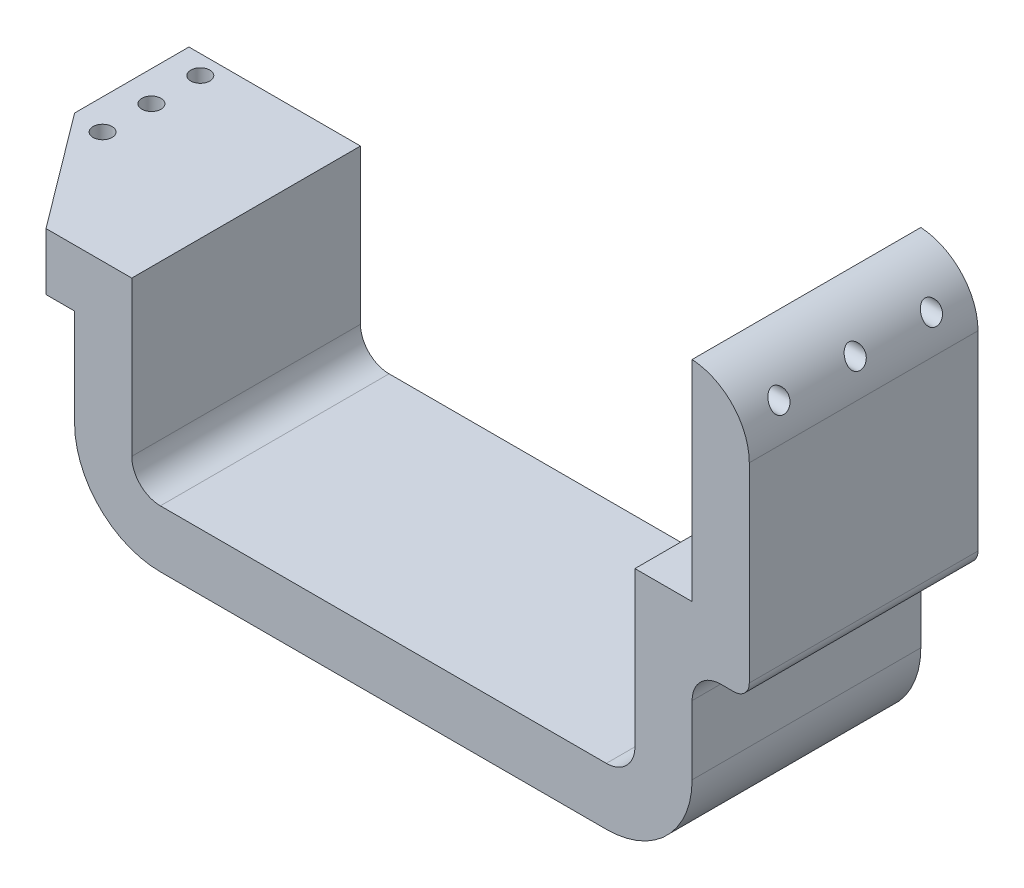
from build123d import *

# Parameters (mm, degrees)
BOSS_EXTRUDE1_DEPTH = 38.1
FILLET1_R           = 2.54
FILLET2_R           = 10.16
CUT_EXTRUDE2_DEPTH  = 91.653895256
SKETCH3_R           = 1.5875
CUT_EXTRUDE3_DEPTH  = 91.653895256
SKETCH4_R           = 1.5875
CUT_EXTRUDE4_DEPTH  = 145.905274839


with BuildPart() as part:
    # Sketch1 → Boss-Extrude1 (new body)
    with BuildSketch(Plane.XY):
        with BuildLine():
            Line((-35.8775, -27.305), (38.4175, -27.305))
            ThreePointArc((38.4175, -27.305), (48.520288136, -23.120288136), (52.705, -13.0175))
            Line((52.705, -13.0175), (52.705, -1.5875))
            ThreePointArc((52.705, -1.5875), (54.099903955, 1.780096045), (57.4675, 3.175))
            Line((57.4675, 3.175), (62.23, 3.175))
            Line((62.23, 3.175), (62.23, 47.625))
            Line((62.23, 47.625), (52.705, 47.625))
            Line((52.705, 47.625), (52.705, 12.7))
            Line((52.705, 12.7), (43.18, 12.7))
            Line((43.18, 12.7), (43.18, -13.0175))
            ThreePointArc((43.18, -13.0175), (41.785096045, -16.385096045), (38.4175, -17.78))
            Line((38.4175, -17.78), (-35.8775, -17.78))
            ThreePointArc((-35.8775, -17.78), (-39.245096045, -16.385096045), (-40.64, -13.0175))
            Line((-40.64, -13.0175), (-40.64, 12.7))
            Line((-40.64, 12.7), (-50.165, 12.7))
            Line((-50.165, 12.7), (-59.69, 12.7))
            Line((-59.69, 12.7), (-69.215, 12.7))
            Line((-69.215, 12.7), (-69.215, 3.175))
            Line((-69.215, 3.175), (-50.165, 3.175))
            Line((-50.165, 3.175), (-50.165, -13.0175))
            ThreePointArc((-50.165, -13.0175), (-45.980288136, -23.120288136), (-35.8775, -27.305))
        make_face()
    extrude(amount=BOSS_EXTRUDE1_DEPTH)

    # Fillet1
    fillet1_edges = [part.edges().sort_by_distance(p)[0] for p in [
        (62.23, 3.175, 19.05),
    ]]
    fillet(fillet1_edges, radius=FILLET1_R)

    # Fillet2
    # the kernel refuses this fillet: 10.16 mm, written as the material it takes off along each edge
    with BuildSketch(Plane(origin=(-69.215, 3.175, -25.350342083), x_dir=(1, 0, 0), z_dir=(0, 0, 1))) as fillet2_piece_1:
        with BuildLine():
            CenterArc((10.140136833, 10.16), FILLET2_R, 183.583321698, 86.416678302)
            Line((0, 9.525), (-0.202802737, 9.5123))
            ThreePointArc((-0.202802737, 9.5123), (-0.2032, 4.7625), (-0.2032, 0))
            Line((-0.2032, 0), (0, -0.2032))
            Line((0, -0.2032), (10.140136833, -0.2032))
            Line((10.140136833, -0.2032), (10.140136833, 0))
        make_face()
    extrude(amount=88.800684167, mode=Mode.SUBTRACT)
    with BuildSketch(Plane(origin=(62.23, 47.625, -25.350342083), x_dir=(0, -1, 0), z_dir=(0, 0, 1))) as fillet2_piece_2:
        with BuildLine():
            CenterArc((10.140136833, -10.16), FILLET2_R, 90, 86.416678302)
            Line((0, -9.525), (-0.202802737, -9.5123))
            ThreePointArc((-0.202802737, -9.5123), (-0.2032, -4.7625), (-0.2032, 0))
            Line((-0.2032, 0), (0, 0.2032))
            Line((0, 0.2032), (10.140136833, 0.2032))
            Line((10.140136833, 0.2032), (10.140136833, 0))
        make_face()
    extrude(amount=88.800684167, mode=Mode.SUBTRACT)

    # Sketch2 → Cut-Extrude2 (cut, through all)
    with BuildSketch(Plane.XZ.offset(-3.175)):
        Polygon((-69.215, 19.05), (-69.215, 44.45), (-50.165, 44.45), align=None)
    extrude(amount=-CUT_EXTRUDE2_DEPTH, mode=Mode.SUBTRACT)

    # Sketch3 → Cut-Extrude3 (cut, through all)
    with BuildSketch(Plane.XZ.offset(-3.175)):
        with Locations((-64.144931583, 3.175)):
            Circle(SKETCH3_R)
        with Locations((-64.144931583, 11.317545611)):
            Circle(SKETCH3_R)
        with Locations((-64.144931583, 19.460091222)):
            Circle(SKETCH3_R)
    extrude(amount=-CUT_EXTRUDE3_DEPTH, mode=Mode.SUBTRACT)

    # Sketch4 → Cut-Extrude4 (cut, through all)
    with BuildSketch(Plane(origin=(62.23, 0, 0), x_dir=(0, 0, -1), z_dir=(1, 0, 0))):
        with Locations((-6.35, 42.554931583)):
            Circle(SKETCH4_R)
        with Locations((-19.05, 42.554931583)):
            Circle(SKETCH4_R)
        with Locations((-31.75, 42.554931583)):
            Circle(SKETCH4_R)
    extrude(amount=-CUT_EXTRUDE4_DEPTH, mode=Mode.SUBTRACT)


solid = part.part
